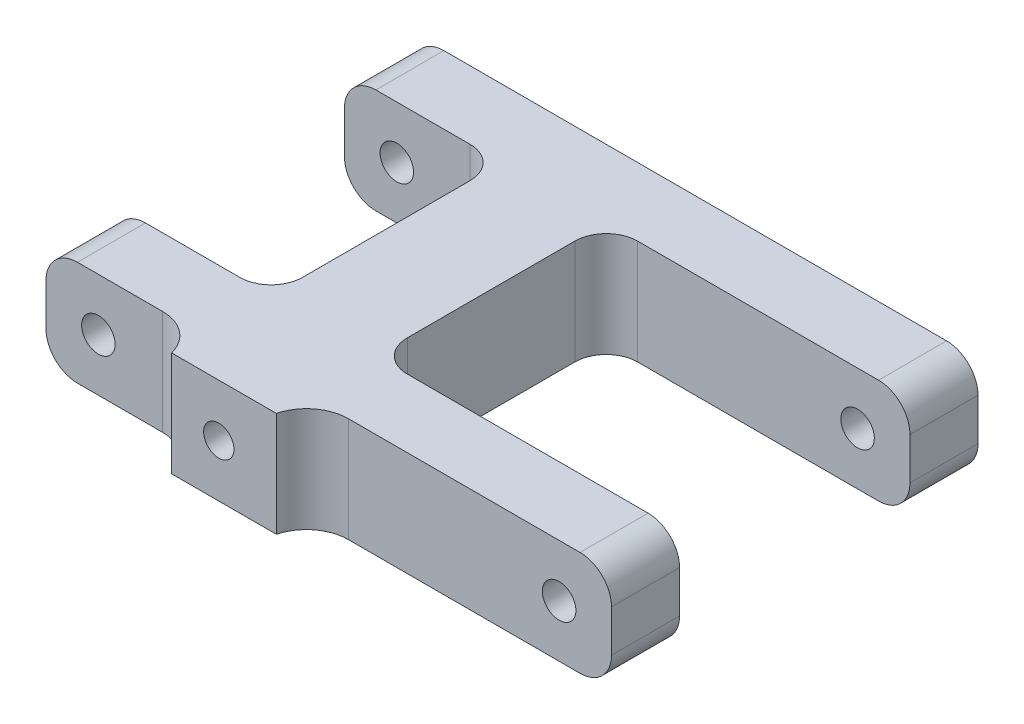
from build123d import *

# Parameters (mm, degrees)
SKETCH1_W               = 54
SKETCH1_H               = 35
BOSS_EXTRUDE1_DEPTH     = 10
SKETCH2_W               = 22
SKETCH2_H               = 10
CUT_EXTRUDE1_DEPTH      = 29
SKETCH3_W               = 22
SKETCH3_H               = 10
CUT_EXTRUDE2_DEPTH      = 15
SKETCH5_R               = 1.6
CUT_EXTRUDE4_DEPTH      = 66.122960621
FILLET1_R               = 3
FILLET2_R               = 3
SKETCH8_W               = 10
SKETCH8_H               = 10
BOSS_EXTRUDE2_DEPTH     = 3
CUT_EXTRUDE5_DEPTH      = 4
CUT_EXTRUDE5_DEPTH_BACK = 15
SKETCH6_R               = 1.45
FILLET3_R               = 4


with BuildPart() as part:
    # Sketch1 → Boss-Extrude1 (new body)
    with BuildSketch(Plane(origin=(0, 0, 0), x_dir=(1, 0, 0), z_dir=(0, 1, 0))):
        with Locations((27, -17.5)):
            Rectangle(SKETCH1_W, SKETCH1_H)
    extrude(amount=BOSS_EXTRUDE1_DEPTH)

    # Sketch2 → Cut-Extrude1 (cut)
    with BuildSketch(Plane(origin=(54, 0, 0), x_dir=(0, 0, -1), z_dir=(1, 0, 0))):
        with Locations((-17.5, 5)):
            Rectangle(SKETCH2_W, SKETCH2_H)
    extrude(amount=-CUT_EXTRUDE1_DEPTH, mode=Mode.SUBTRACT)

    # Sketch3 → Cut-Extrude2 (cut)
    with BuildSketch(Plane.ZY):
        with Locations((17.5, 5)):
            Rectangle(SKETCH3_W, SKETCH3_H)
    extrude(amount=-CUT_EXTRUDE2_DEPTH, mode=Mode.SUBTRACT)

    # Sketch5 → Cut-Extrude4 (cut, through all)
    with BuildSketch(Plane.XY.offset(35)):
        with Locations((5, 5)):
            Circle(SKETCH5_R)
        with Locations((49, 5)):
            Circle(SKETCH5_R)
    extrude(amount=-CUT_EXTRUDE4_DEPTH, mode=Mode.SUBTRACT)

    # Fillet1
    fillet1_edges = [part.edges().sort_by_distance(p)[0] for p in [
        (54, 10, 31.75),
        (54, 0, 3.25),
        (54, 10, 3.25),
        (0, 0, 31.75),
        (0, 10, 31.75),
        (0, 10, 3.25),
        (54, 0, 31.75),
        (0, 0, 3.25),
    ]]
    fillet(fillet1_edges, radius=FILLET1_R)

    # Fillet2
    fillet2_edges = [part.edges().sort_by_distance(p)[0] for p in [
        (25, 5, 28.5),
        (25, 5, 6.5),
        (15, 5, 6.5),
        (15, 5, 28.5),
    ]]
    fillet(fillet2_edges, radius=FILLET2_R)

    # Sketch8 → Boss-Extrude2 (add)
    with BuildSketch(Plane.XY.offset(35)):
        with Locations((20, 5)):
            Rectangle(SKETCH8_W, SKETCH8_H)
    extrude(amount=BOSS_EXTRUDE2_DEPTH)

    # Sketch6 → Cut-Extrude5 (cut, two sides: drawn at the far end of the back side and taken through both)
    with BuildSketch(Plane.XY.offset(35).offset(-CUT_EXTRUDE5_DEPTH_BACK)):
        with Locations((19.5, 5)):
            Circle(SKETCH6_R)
    extrude(amount=CUT_EXTRUDE5_DEPTH + CUT_EXTRUDE5_DEPTH_BACK, mode=Mode.SUBTRACT)

    # Fillet3
    # the kernel refuses this fillet: 4 mm, written as the material it adds along each edge
    with BuildSketch(Plane(origin=(25, 10, 35), x_dir=(0, 0, 1), z_dir=(0, -1, 0))) as fillet3_piece_1:
        with BuildLine():
            CenterArc((4, -3.872983346), FILLET3_R, 104.477512186, 75.522487814)
            Line((0, -3.872983346), (-0.08, -3.872983346))
            Line((-0.08, -3.872983346), (-0.08, 0))
            Line((-0.08, 0), (0, 0.08))
            ThreePointArc((0, 0.08), (1.5, 0.08), (2.98, 0.077459667))
            Line((2.98, 0.077459667), (3, 0))
        make_face()
    extrude(amount=10)
    with BuildSketch(Plane(origin=(15, 0, 35), x_dir=(-1, 0, 0), z_dir=(0, 1, 0))) as fillet3_piece_2:
        with BuildLine():
            CenterArc((3.872983346, 4), FILLET3_R, 194.477512186, 75.522487814)
            Line((0, 3), (-0.077459667, 2.98))
            ThreePointArc((-0.077459667, 2.98), (-0.08, 1.5), (-0.08, 0))
            Line((-0.08, 0), (0, -0.08))
            Line((0, -0.08), (3.872983346, -0.08))
            Line((3.872983346, -0.08), (3.872983346, 0))
        make_face()
    extrude(amount=10)


solid = part.part
